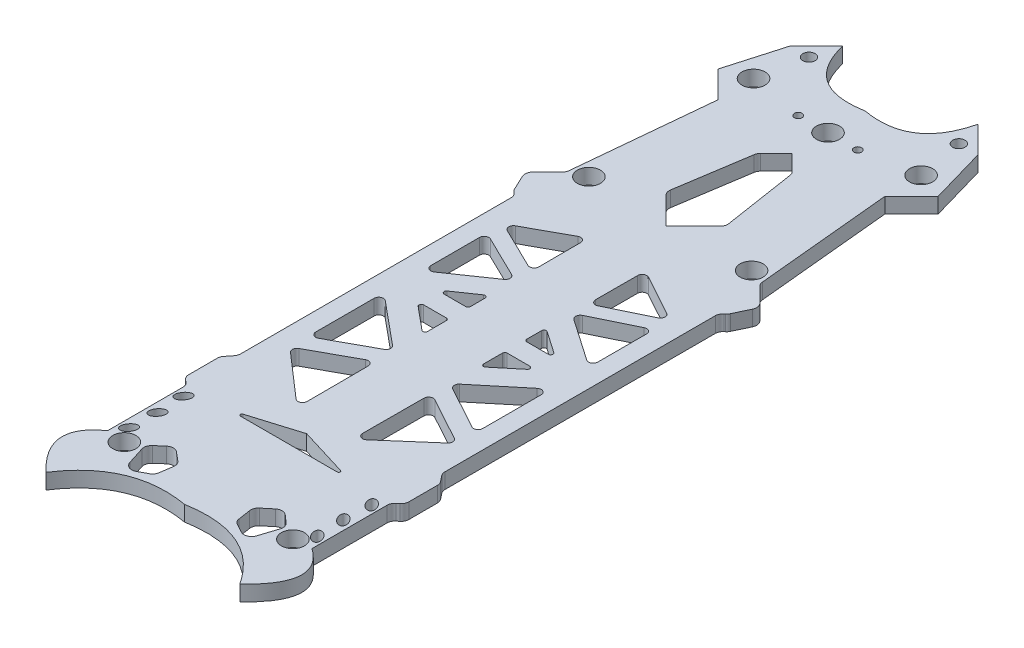
from build123d import *

# Parameters (mm, degrees)
SKETCH1_R           = 7.5
SKETCH1_R_2         = 4
SKETCH1_R_3         = 2.5
SKETCH1_RX          = 4.927409778
SKETCH1_RY          = 3.031843577
SKETCH1_RX_2        = 4.907271991
BOSS_EXTRUDE1_DEPTH = 10
QUADFINALASSEMBLY_R = 7.5
CUT_EXTRUDE1_DEPTH  = 10
SCALE1_SCALE        = 0.5


with BuildPart() as part:
    # Sketch1 → Boss-Extrude1 (new body)
    with BuildSketch(Plane(origin=(0, 0, 0), x_dir=(1, 0, 0), z_dir=(0, 1, 0))):
        with BuildLine():
            Line((-44.015363128, 319.712290503), (-61.194876326, 302.532777305))
            Line((-61.194876326, 302.532777305), (-71.641987854, 266.189184764))
            Line((-71.641987854, 266.189184764), (-54.323350633, 248.870547543))
            Line((-54.323350633, 248.870547543), (-62.810720333, 160.657686073))
            ThreePointArc((-62.810720333, 160.657686073), (-63.265382303, 159.003870941), (-64.252202731, 157.601014055))
            Line((-64.252202731, 157.601014055), (-73.84301483, 148.010201957))
            ThreePointArc((-73.84301483, 148.010201957), (-75.234628191, 145.325091361), (-74.823613849, 142.328848068))
            Line((-74.823613849, 142.328848068), (-70.16083341, 132.515473026))
            ThreePointArc((-70.16083341, 132.515473026), (-69.55518256, 131.545505799), (-68.744990133, 130.73851286))
            Line((-68.744990133, 130.73851286), (-68.318142441, 130.401162453))
            ThreePointArc((-68.318142441, 130.401162453), (-66.918351633, 128.657665645), (-66.41843209, 126.478382304))
            Line((-66.41843209, 126.478382304), (-66.41843209, -49.362946005))
            ThreePointArc((-66.41843209, -49.362946005), (-66.695408655, -51.003997384), (-67.495651942, -52.463235654))
            Line((-67.495651942, -52.463235654), (-70.502935757, -56.268336011))
            ThreePointArc((-70.502935757, -56.268336011), (-71.303179044, -57.727574281), (-71.580155608, -59.36862566))
            Line((-71.580155608, -59.36862566), (-71.580155608, -77.957335659))
            ThreePointArc((-71.580155608, -77.957335659), (-71.080236066, -80.136618999), (-69.680445257, -81.880115807))
            Line((-69.680445257, -81.880115807), (-68.318142441, -82.95678418))
            ThreePointArc((-68.318142441, -82.95678418), (-66.918351633, -84.700280988), (-66.41843209, -86.879564329))
            Line((-66.41843209, -86.879564329), (-66.41843209, -135.810193909))
            add(Edge.make_bspline(
                [(-66.41843209, -135.810193909), (-90.916316148, -152.995517415), (-62.982669244, -179.287709497)],
                knots=[0, 0, 0, 1, 1, 1], degree=2))
            add(Edge.make_bspline(
                [(-62.982669244, -179.287709497), (-40.800153925, -145.262472865), (0, -152.302203181)],
                knots=[0, 0, 0, 1, 1, 1], degree=2))
            add(Edge.make_bspline(
                [(62.982669244, -179.287709497), (40.800153925, -145.262472865), (0, -152.302203181)],
                knots=[0, 0, 0, 1, 1, 1], degree=2))
            add(Edge.make_bspline(
                [(66.41843209, -135.810193909), (90.916316148, -152.995517415), (62.982669244, -179.287709497)],
                knots=[0, 0, 0, 1, 1, 1], degree=2))
            Line((66.41843209, -135.810193909), (66.41843209, -86.879564329))
            ThreePointArc((66.41843209, -86.879564329), (66.918351633, -84.700280988), (68.318142441, -82.95678418))
            Line((68.318142441, -82.95678418), (69.680445257, -81.880115807))
            ThreePointArc((69.680445257, -81.880115807), (71.080236066, -80.136618999), (71.580155608, -77.957335659))
            Line((71.580155608, -77.957335659), (71.580155608, -59.36862566))
            ThreePointArc((71.580155608, -59.36862566), (71.303179044, -57.727574281), (70.502935757, -56.268336011))
            Line((70.502935757, -56.268336011), (67.495651942, -52.463235654))
            ThreePointArc((67.495651942, -52.463235654), (66.695408655, -51.003997384), (66.41843209, -49.362946005))
            Line((66.41843209, -49.362946005), (66.41843209, 126.478382304))
            ThreePointArc((66.41843209, 126.478382304), (66.918351633, 128.657665645), (68.318142441, 130.401162453))
            Line((68.318142441, 130.401162453), (68.744990133, 130.73851286))
            ThreePointArc((68.744990133, 130.73851286), (69.55518256, 131.545505799), (70.16083341, 132.515473026))
            Line((70.16083341, 132.515473026), (74.823613849, 142.328848068))
            ThreePointArc((74.823613849, 142.328848068), (75.234628191, 145.325091361), (73.84301483, 148.010201957))
            Line((73.84301483, 148.010201957), (64.252202731, 157.601014055))
            ThreePointArc((64.252202731, 157.601014055), (63.265382303, 159.003870941), (62.810720333, 160.657686073))
            Line((62.810720333, 160.657686073), (54.323350633, 248.870547543))
            Line((54.323350633, 248.870547543), (71.641987854, 266.189184764))
            Line((71.641987854, 266.189184764), (61.194876326, 302.532777305))
            Line((61.194876326, 302.532777305), (44.015363128, 319.712290503))
            add(Edge.make_bspline(
                [(0, 290.49604402), (35.375440578, 284.205888068), (44.015363128, 319.712290503)],
                knots=[0, 0, 0, 1, 1, 1], degree=2))
            add(Edge.make_bspline(
                [(0, 290.49604402), (-35.375440578, 284.205888068), (-44.015363128, 319.712290503)],
                knots=[0, 0, 0, 1, 1, 1], degree=2))
        make_face()
        with Locations((0, 266.189184764)):
            Circle(SKETCH1_R, mode=Mode.SUBTRACT)
        with Locations((-48.738250242, 302.532777305)):
            Circle(SKETCH1_R_2, mode=Mode.SUBTRACT)
        with Locations((-19.350997922, 266.189184764)):
            Circle(SKETCH1_R_3, mode=Mode.SUBTRACT)
        with Locations((19.350997922, 266.189184764)):
            Circle(SKETCH1_R_3, mode=Mode.SUBTRACT)
        with Locations((48.738250242, 302.532777305)):
            Circle(SKETCH1_R_2, mode=Mode.SUBTRACT)
        with Locations(Location((-61.194876326, -91.693432296), (0, 0, -125.729247999))):
            Ellipse(SKETCH1_RX, SKETCH1_RY, mode=Mode.SUBTRACT)
        with Locations(Location((-61.194876326, -127.120085749), (0, 0, -125.401084379))):
            Ellipse(SKETCH1_RX_2, SKETCH1_RY, mode=Mode.SUBTRACT)
        with Locations(Location((-60.440098802, -109.406759023), (0, 0, 54.270752001))):
            Ellipse(SKETCH1_RX, SKETCH1_RY, mode=Mode.SUBTRACT)
        with Locations(Location((60.440098802, -109.406759023), (0, 0, -54.270752001))):
            Ellipse(SKETCH1_RX, SKETCH1_RY, mode=Mode.SUBTRACT)
        with Locations(Location((61.194876326, -127.120085749), (0, 0, -54.598915621))):
            Ellipse(SKETCH1_RX_2, SKETCH1_RY, mode=Mode.SUBTRACT)
        with Locations(Location((61.194876326, -91.693432296), (0, 0, -54.270752001))):
            Ellipse(SKETCH1_RX, SKETCH1_RY, mode=Mode.SUBTRACT)
        with BuildLine():
            Line((0, -72.7995714), (-31.726180192, -82.501899362))
            ThreePointArc((-31.726180192, -82.501899362), (-32.422745323, -83.606029033), (-31.43373513, -84.458181688))
            Line((-31.43373513, -84.458181688), (31.43373513, -84.458181688))
            ThreePointArc((31.43373513, -84.458181688), (32.422745323, -83.606029033), (31.726180192, -82.501899362))
            Line((31.726180192, -82.501899362), (0, -72.7995714))
        make_face(mode=Mode.SUBTRACT)
        with BuildLine():
            Line((-34.148431598, -149.458647214), (-28.589073197, -146.474425838))
            ThreePointArc((-28.589073197, -146.474425838), (-26.863835518, -144.945046785), (-26.008212004, -142.804169923))
            Line((-26.008212004, -142.804169923), (-24.792933938, -134.628662934))
            ThreePointArc((-24.792933938, -134.628662934), (-25.065194205, -132.116040195), (-26.531488624, -130.057550612))
            Line((-26.531488624, -130.057550612), (-32.163449323, -125.348862159))
            ThreePointArc((-32.163449323, -125.348862159), (-35.432844577, -124.185197165), (-38.672232348, -125.42995755))
            Line((-38.672232348, -125.42995755), (-43.522986687, -129.695276021))
            ThreePointArc((-43.522986687, -129.695276021), (-45.040020303, -132.115960908), (-44.984012611, -134.97217684))
            Line((-44.984012611, -134.97217684), (-41.27593404, -146.575275189))
            ThreePointArc((-41.27593404, -146.575275189), (-38.388315093, -149.688314878), (-34.148431598, -149.458647214))
        make_face(mode=Mode.SUBTRACT)
        with BuildLine():
            Line((0, 242.884882306), (-10.248995025, 232.635887282))
            ThreePointArc((-10.248995025, 232.635887282), (-11.17220318, 231.363010934), (-11.654436843, 229.866355266))
            Line((-11.654436843, 229.866355266), (-18.962278426, 182.72826287))
            ThreePointArc((-18.962278426, 182.72826287), (-18.774049953, 180.409394736), (-17.556836608, 178.426727074))
            Line((-17.556836608, 178.426727074), (0, 160.869890466))
            Line((0, 160.869890466), (17.556836608, 178.426727074))
            ThreePointArc((17.556836608, 178.426727074), (18.774049953, 180.409394736), (18.962278426, 182.72826287))
            Line((18.962278426, 182.72826287), (11.654436843, 229.866355266))
            ThreePointArc((11.654436843, 229.866355266), (11.17220318, 231.363010934), (10.248995025, 232.635887282))
            Line((10.248995025, 232.635887282), (0, 242.884882306))
        make_face(mode=Mode.SUBTRACT)
        with BuildLine():
            Line((-22.987301407, 126.47184301), (-49.242933429, 112.072598001))
            ThreePointArc((-49.242933429, 112.072598001), (-50.799503231, 109.370554013), (-49.115680493, 106.745922183))
            Line((-49.115680493, 106.745922183), (-22.776512295, 93.896934897))
            ThreePointArc((-22.776512295, 93.896934897), (-19.867633073, 94.051449615), (-18.461204845, 96.602412722))
            Line((-18.461204845, 96.602412722), (-18.544741021, 123.850645016))
            ThreePointArc((-18.544741021, 123.850645016), (-20.020242646, 126.425233354), (-22.987301407, 126.47184301))
        make_face(mode=Mode.SUBTRACT)
        with BuildLine():
            Line((-23.027673411, 83.47126431), (-50.008029085, 96.633040886))
            ThreePointArc((-50.008029085, 96.633040886), (-52.913010244, 96.480965895), (-54.323350633, 93.936760258))
            Line((-54.323350633, 93.936760258), (-54.323350633, 62.161751592))
            ThreePointArc((-54.323350633, 62.161751592), (-52.717852376, 59.505557907), (-49.619774041, 59.692373777))
            Line((-49.619774041, 59.692373777), (-22.639418367, 78.305605867))
            ThreePointArc((-22.639418367, 78.305605867), (-21.351432946, 80.99983189), (-23.027673411, 83.47126431))
        make_face(mode=Mode.SUBTRACT)
        with BuildLine():
            Line((-20.705788487, 62.866272173), (-34.708230877, 53.206254596))
            ThreePointArc((-34.708230877, 53.206254596), (-35.288579684, 51.525490225), (-33.856442581, 50.471565688))
            Line((-33.856442581, 50.471565688), (-19.824385025, 50.471565688))
            ThreePointArc((-19.824385025, 50.471565688), (-18.762100247, 50.912532615), (-18.324392074, 51.976164287))
            Line((-18.324392074, 51.976164287), (-18.35400724, 61.636181864))
            ThreePointArc((-18.35400724, 61.636181864), (-19.158785936, 62.960747341), (-20.705788487, 62.866272173))
        make_face(mode=Mode.SUBTRACT)
        with BuildLine():
            Line((-19.77626626, 37.775955156), (-34.51061806, 37.775955156))
            ThreePointArc((-34.51061806, 37.775955156), (-35.921752518, 36.784580304), (-35.467602692, 35.120887878))
            Line((-35.467602692, 35.120887878), (-20.695730316, 22.882245921))
            ThreePointArc((-20.695730316, 22.882245921), (-19.098495152, 22.680817988), (-18.238752733, 24.041911797))
            Line((-18.238752733, 24.041911797), (-18.276273309, 36.280553754))
            ThreePointArc((-18.276273309, 36.280553754), (-18.717233186, 37.338239933), (-19.77626626, 37.775955156))
        make_face(mode=Mode.SUBTRACT)
        with BuildLine():
            Line((-49.40938137, 27.700684633), (-21.814357894, 4.837935516))
            ThreePointArc((-21.814357894, 4.837935516), (-20.741890314, 2.242853636), (-22.285752673, -0.102594229))
            Line((-22.285752673, -0.102594229), (-49.880776149, -15.236394997))
            ThreePointArc((-49.880776149, -15.236394997), (-52.851793722, -15.187445473), (-54.323350633, -12.605999807))
            Line((-54.323350633, -12.605999807), (-54.323350633, 25.390550078))
            ThreePointArc((-54.323350633, 25.390550078), (-52.599691538, 28.10550015), (-49.40938137, 27.700684633))
        make_face(mode=Mode.SUBTRACT)
        with BuildLine():
            Line((-50.55161358, -27.372099964), (-22.562713493, -12.022287415))
            ThreePointArc((-22.562713493, -12.022287415), (-19.595654732, -12.068897071), (-18.120153107, -14.643485409))
            Line((-18.120153107, -14.643485409), (-17.998067131, -54.466076873))
            ThreePointArc((-17.998067131, -54.466076873), (-19.750792103, -57.203705885), (-22.967892517, -56.737956639))
            Line((-22.967892517, -56.737956639), (-51.078878579, -32.265177723))
            ThreePointArc((-51.078878579, -32.265177723), (-52.091771863, -29.681083832), (-50.55161358, -27.372099964))
        make_face(mode=Mode.SUBTRACT)
        with BuildLine():
            Line((50.55161358, -27.372099964), (22.562713493, -12.022287415))
            ThreePointArc((22.562713493, -12.022287415), (19.595654732, -12.068897071), (18.120153107, -14.643485409))
            Line((18.120153107, -14.643485409), (17.998067131, -54.466076873))
            ThreePointArc((17.998067131, -54.466076873), (19.750792103, -57.203705885), (22.967892517, -56.737956639))
            Line((22.967892517, -56.737956639), (51.078878579, -32.265177723))
            ThreePointArc((51.078878579, -32.265177723), (52.091771863, -29.681083832), (50.55161358, -27.372099964))
        make_face(mode=Mode.SUBTRACT)
        with BuildLine():
            Line((54.323350633, -12.605999807), (54.323350633, 25.390550078))
            ThreePointArc((54.323350633, 25.390550078), (52.599691538, 28.10550015), (49.40938137, 27.700684633))
            Line((49.40938137, 27.700684633), (21.814357894, 4.837935516))
            ThreePointArc((21.814357894, 4.837935516), (20.741890314, 2.242853636), (22.285752673, -0.102594229))
            Line((22.285752673, -0.102594229), (49.880776149, -15.236394997))
            ThreePointArc((49.880776149, -15.236394997), (52.851793722, -15.187445473), (54.323350633, -12.605999807))
        make_face(mode=Mode.SUBTRACT)
        with BuildLine():
            Line((18.238752733, 24.041911797), (18.276273309, 36.280553754))
            ThreePointArc((18.276273309, 36.280553754), (18.717233186, 37.338239933), (19.77626626, 37.775955156))
            Line((19.77626626, 37.775955156), (34.51061806, 37.775955156))
            ThreePointArc((34.51061806, 37.775955156), (35.921752518, 36.784580304), (35.467602692, 35.120887878))
            Line((35.467602692, 35.120887878), (20.695730316, 22.882245921))
            ThreePointArc((20.695730316, 22.882245921), (19.098495152, 22.680817988), (18.238752733, 24.041911797))
        make_face(mode=Mode.SUBTRACT)
        with BuildLine():
            Line((18.324392074, 51.976164287), (18.35400724, 61.636181864))
            ThreePointArc((18.35400724, 61.636181864), (19.158785936, 62.960747341), (20.705788487, 62.866272173))
            Line((20.705788487, 62.866272173), (34.708230877, 53.206254596))
            ThreePointArc((34.708230877, 53.206254596), (35.288579684, 51.525490225), (33.856442581, 50.471565688))
            Line((33.856442581, 50.471565688), (19.824385025, 50.471565688))
            ThreePointArc((19.824385025, 50.471565688), (18.762100247, 50.912532615), (18.324392074, 51.976164287))
        make_face(mode=Mode.SUBTRACT)
        with BuildLine():
            Line((49.619774041, 59.692373777), (22.639418367, 78.305605867))
            ThreePointArc((22.639418367, 78.305605867), (21.351432946, 80.99983189), (23.027673411, 83.47126431))
            Line((23.027673411, 83.47126431), (50.008029085, 96.633040886))
            ThreePointArc((50.008029085, 96.633040886), (52.913010244, 96.480965895), (54.323350633, 93.936760258))
            Line((54.323350633, 93.936760258), (54.323350633, 62.161751592))
            ThreePointArc((54.323350633, 62.161751592), (52.717852376, 59.505557907), (49.619774041, 59.692373777))
        make_face(mode=Mode.SUBTRACT)
        with BuildLine():
            Line((18.461204845, 96.602412722), (18.544741021, 123.850645016))
            ThreePointArc((18.544741021, 123.850645016), (20.020242646, 126.425233354), (22.987301407, 126.47184301))
            Line((22.987301407, 126.47184301), (49.242933429, 112.072598001))
            ThreePointArc((49.242933429, 112.072598001), (50.799503231, 109.370554013), (49.115680493, 106.745922183))
            Line((49.115680493, 106.745922183), (22.776512295, 93.896934897))
            ThreePointArc((22.776512295, 93.896934897), (19.867633073, 94.051449615), (18.461204845, 96.602412722))
        make_face(mode=Mode.SUBTRACT)
        with BuildLine():
            Line((44.984012611, -134.97217684), (41.27593404, -146.575275189))
            ThreePointArc((41.27593404, -146.575275189), (38.388315093, -149.688314878), (34.148431598, -149.458647214))
            Line((34.148431598, -149.458647214), (28.589073197, -146.474425838))
            ThreePointArc((28.589073197, -146.474425838), (26.863835518, -144.945046785), (26.008212004, -142.804169923))
            Line((26.008212004, -142.804169923), (24.792933938, -134.628662934))
            ThreePointArc((24.792933938, -134.628662934), (25.065194205, -132.116040195), (26.531488624, -130.057550612))
            Line((26.531488624, -130.057550612), (32.163449323, -125.348862159))
            ThreePointArc((32.163449323, -125.348862159), (35.432844577, -124.185197165), (38.672232348, -125.42995755))
            Line((38.672232348, -125.42995755), (43.522986687, -129.695276021))
            ThreePointArc((43.522986687, -129.695276021), (45.040020303, -132.115960908), (44.984012611, -134.97217684))
        make_face(mode=Mode.SUBTRACT)
    extrude(amount=BOSS_EXTRUDE1_DEPTH)

    # QuadFinalAssembly → Cut-Extrude1 (cut)
    with BuildSketch(Plane(origin=(0, 10, 0), x_dir=(1, 0, 0), z_dir=(0, 1, 0))):
        with Locations((54.978057048, -136.722937053)):
            Circle(QUADFINALASSEMBLY_R)
        with Locations((-54.718323453, 272.473453121)):
            Circle(QUADFINALASSEMBLY_R)
        with Locations((-54.56868406, -136.831103922)):
            Circle(QUADFINALASSEMBLY_R)
        with Locations((54.230116589, 272.472914078)):
            Circle(QUADFINALASSEMBLY_R)
        with Locations((-52.934284887, 163.644514354)):
            Circle(QUADFINALASSEMBLY_R)
        with Locations((52.750280101, 163.748867696)):
            Circle(QUADFINALASSEMBLY_R)
    extrude(amount=-CUT_EXTRUDE1_DEPTH, mode=Mode.SUBTRACT)


with BuildPart() as part_1:
    # Scale1: scaled about (0.000953971, 5, -66.265152228)
    add(part.part.scale(SCALE1_SCALE).moved(Location((0.000476985, 2.5, -33.132576114))))


solid = part_1.part
